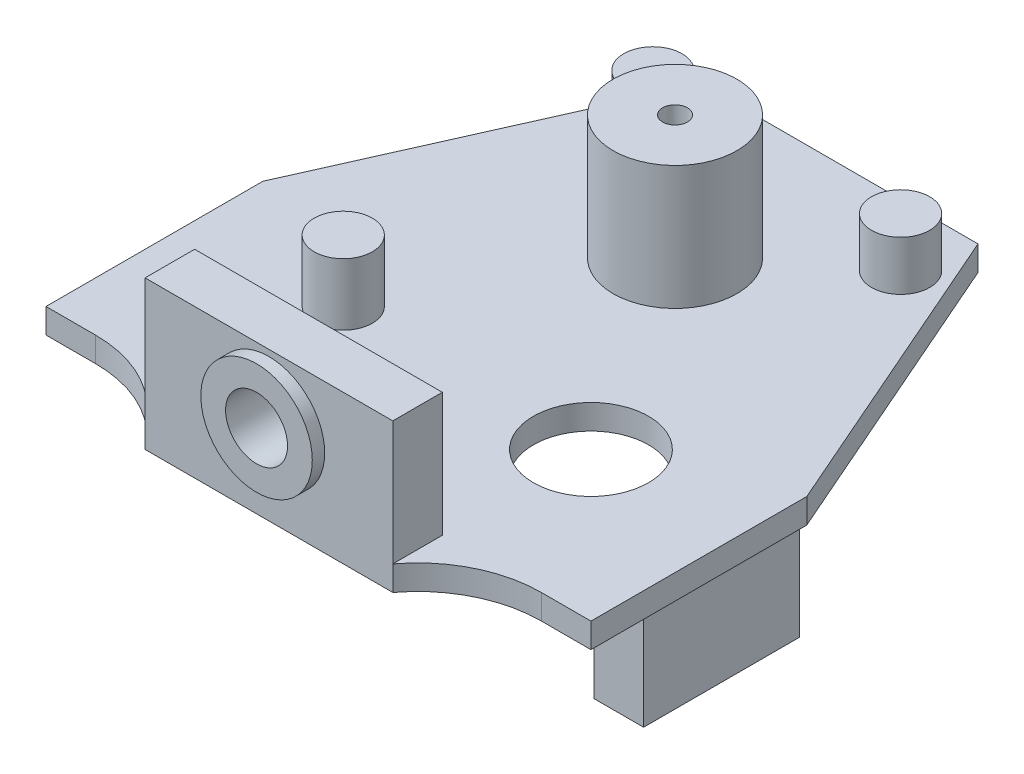
from build123d import *

# Parameters (mm, degrees)
SKETCH1_W                     = 40
SKETCH1_H                     = 20
BOSS_EXTRUDE1_DEPTH           = 2
SKETCH5_W                     = 50
SKETCH5_H                     = 20
BOSS_EXTRUDE4_DEPTH           = 2
SKETCH6_R                     = 2.35
BOSS_EXTRUDE5_DEPTH           = 4
SKETCH15_R                    = 4.65
CUT_EXTRUDE6_DEPTH            = 6
SKETCH17_W                    = 10
SKETCH17_H                    = 20
CUT_EXTRUDE8_DEPTH            = 43.614551505
CUT_EXTRUDE9_DEPTH            = 2
SKETCH19_R                    = 2.35
BOSS_EXTRUDE6_DEPTH           = 5
BOSS_EXTRUDE7_DEPTH           = 2
SKETCH21_R                    = 5
BOSS_EXTRUDE8_DEPTH           = 10
SKETCH22_R                    = 1
CUT_EXTRUDE10_DEPTH           = 8
CUT_EXTRUDE10_DRAFT           = -1
SKETCH23_W                    = 4
SKETCH23_H                    = 12.6
SKETCH23_H_2                  = 12.600139219
BOSS_EXTRUDE9_DEPTH           = 9
SKETCH24_R                    = 1
CUT_EXTRUDE11_DEPTH           = 6
CUT_EXTRUDE11_DRAFT           = -1
CUT_EXTRUDE11_PROFILE_2_DEPTH = 6
CUT_EXTRUDE11_PROFILE_2_DRAFT = -1
SKETCH25_W                    = 20
SKETCH25_H                    = 2
BOSS_EXTRUDE10_DEPTH          = 4
SKETCH26_W                    = 20
SKETCH26_H                    = 4
BOSS_EXTRUDE11_DEPTH          = 10
FILLET1_R                     = 10
SKETCH27_R                    = 1
CUT_EXTRUDE13_DEPTH           = 49.908077043
SKETCH28_R                    = 2.5
CUT_EXTRUDE14_DEPTH           = 3
BOSS_EXTRUDE12_START          = 1
SKETCH29_R                    = 4.5
SKETCH29_R_2                  = 2.5
BOSS_EXTRUDE12_DEPTH          = 1


with BuildPart() as part:
    # Sketch1 → Boss-Extrude1 (new body)
    with BuildSketch(Plane(origin=(0, 0, 0), x_dir=(1, 0, 0), z_dir=(0, 1, 0))):
        Rectangle(SKETCH1_W, SKETCH1_H)
    extrude(amount=BOSS_EXTRUDE1_DEPTH)

    # Sketch5 → Boss-Extrude4 (add)
    with BuildSketch(Plane(origin=(0, 2, 0), x_dir=(1, 0, 0), z_dir=(0, 1, 0))):
        with Locations((5, 20)):
            Rectangle(SKETCH5_W, SKETCH5_H)
    extrude(amount=-BOSS_EXTRUDE4_DEPTH)

    # Sketch6 → Boss-Extrude5 (add)
    with BuildSketch(Plane(origin=(0, 2, 0), x_dir=(1, 0, 0), z_dir=(0, 1, 0))):
        with Locations(Location((-10, 25, 0), (0, 0, 270))):
            Circle(SKETCH6_R)
        with Locations(Location((10, 25, 0), (0, 0, 270))):
            Circle(SKETCH6_R)
    extrude(amount=BOSS_EXTRUDE5_DEPTH)

    # Sketch15 → Cut-Extrude6 (cut)
    with BuildSketch(Plane(origin=(0, 2, 0), x_dir=(1, 0, 0), z_dir=(0, 1, 0))):
        with Locations(Location((10, 0, 0), (0, 0, 270))):
            Circle(SKETCH15_R)
    extrude(amount=-CUT_EXTRUDE6_DEPTH, mode=Mode.SUBTRACT)

    # Sketch17 → Cut-Extrude8 (cut, through all)
    with BuildSketch(Plane(origin=(0, 2, 0), x_dir=(1, 0, 0), z_dir=(0, 1, 0))):
        with Locations((25, 20)):
            Rectangle(SKETCH17_W, SKETCH17_H)
    extrude(amount=-CUT_EXTRUDE8_DEPTH, mode=Mode.SUBTRACT)

    # Sketch18 → Cut-Extrude9 (cut)
    with BuildSketch(Plane(origin=(0, 2, 0), x_dir=(1, 0, 0), z_dir=(0, 1, 0))):
        Polygon((-11.1, 30), (-20, 10), (-20, 30), align=None)
        Polygon((20, 10), (11.25, 30), (20, 30), align=None)
    extrude(amount=-CUT_EXTRUDE9_DEPTH, mode=Mode.SUBTRACT)

    # Sketch19 → Boss-Extrude6 (add)
    with BuildSketch(Plane(origin=(0, 2, 0), x_dir=(1, 0, 0), z_dir=(0, 1, 0))):
        with Locations(Location((-10, 0, 0), (0, 0, 270))):
            Circle(SKETCH19_R)
    extrude(amount=BOSS_EXTRUDE6_DEPTH)

    # Sketch20 → Boss-Extrude7 (add)
    with BuildSketch(Plane(origin=(0, 2, 0), x_dir=(1, 0, 0), z_dir=(0, 1, 0))):
        Polygon((-20, 10), (-22, 5.505617978), (-22, -12), (-20, -12), (20, -12), (22, -12), (22, 5.428571429), (20, 10), (20, -10), (-20, -10), align=None)
    extrude(amount=-BOSS_EXTRUDE7_DEPTH)

    # Sketch21 → Boss-Extrude8 (add)
    with BuildSketch(Plane(origin=(0, 2, 0), x_dir=(1, 0, 0), z_dir=(0, 1, 0))):
        with Locations(Location((0, 16.787751337, 0), (0, 0, 270))):
            Circle(SKETCH21_R)
    extrude(amount=BOSS_EXTRUDE8_DEPTH)


with BuildPart() as cut_extrude10_tool:
    # Sketch22 → Cut-Extrude10 (with draft: the straight prism first)
    with BuildSketch(Plane(origin=(0, 12, 0), x_dir=(1, 0, 0), z_dir=(0, 1, 0))):
        with Locations((0, 16.787751337)):
            Circle(SKETCH22_R)
    extrude(amount=-CUT_EXTRUDE10_DEPTH)
    # Cut-Extrude10: the draft: its side faces are tilted about the plane it starts from
    cut_extrude10_sides = [cut_extrude10_tool.faces().sort_by_distance(p)[0] for p in [
        (-1, 8, -16.787751337),
    ]]
    draft(cut_extrude10_sides, Plane(origin=(0, 12, 0), x_dir=(1, 0, 0), z_dir=(0, 1, 0)), CUT_EXTRUDE10_DRAFT)


with BuildPart() as part_1:
    add(part.part)

    # Cut-Extrude10: cut by cut_extrude10_tool
    add(cut_extrude10_tool.part, mode=Mode.SUBTRACT)

    # Sketch23 → Boss-Extrude9 (add)
    with BuildSketch(Plane.XZ):
        with Locations((-9.55, 0)):
            Rectangle(SKETCH23_W, SKETCH23_H)
        with Locations((18.549999997, 8.8752e-05)):
            Rectangle(SKETCH23_W, SKETCH23_H_2)
    extrude(amount=BOSS_EXTRUDE9_DEPTH)


with BuildPart() as cut_extrude11_tool:
    # Sketch24 → Cut-Extrude11 (with draft: the straight prism first)
    with BuildSketch(Plane.XZ.offset(9)):
        with Locations((18.267131572, 0.01512814)):
            Circle(SKETCH24_R)
    extrude(amount=-CUT_EXTRUDE11_DEPTH)
    # Cut-Extrude11: the draft: its side faces are tilted about the plane it starts from
    cut_extrude11_sides = [cut_extrude11_tool.faces().sort_by_distance(p)[0] for p in [
        (17.267131572, -6, 0.01512814),
    ]]
    draft(cut_extrude11_sides, Plane.XZ.offset(9), CUT_EXTRUDE11_DRAFT)


with BuildPart() as part_2:
    add(part_1.part)

    # Cut-Extrude11: cut by cut_extrude11_tool
    add(cut_extrude11_tool.part, mode=Mode.SUBTRACT)


with BuildPart() as cut_extrude11_profile_2_tool:
    # Sketch24 → Cut-Extrude11 profile 2 (with draft: the straight prism first)
    with BuildSketch(Plane.XZ.offset(9)):
        with Locations((-9.275, 0)):
            Circle(SKETCH24_R)
    extrude(amount=-CUT_EXTRUDE11_PROFILE_2_DEPTH)
    # Cut-Extrude11 profile 2: the draft: its side faces are tilted about the plane it starts from
    cut_extrude11_profile_2_sides = [cut_extrude11_profile_2_tool.faces().sort_by_distance(p)[0] for p in [
        (-10.275, -6, 0),
    ]]
    draft(cut_extrude11_profile_2_sides, Plane.XZ.offset(9), CUT_EXTRUDE11_PROFILE_2_DRAFT)


with BuildPart() as part_3:
    add(part_2.part)

    # Cut-Extrude11 profile 2: cut by cut_extrude11_profile_2_tool
    add(cut_extrude11_profile_2_tool.part, mode=Mode.SUBTRACT)

    # Sketch25 → Boss-Extrude10 (add)
    with BuildSketch(Plane.XY.offset(12)):
        with Locations((0, 1)):
            Rectangle(SKETCH25_W, SKETCH25_H)
    extrude(amount=BOSS_EXTRUDE10_DEPTH)

    # Sketch26 → Boss-Extrude11 (add)
    with BuildSketch(Plane(origin=(0, 2, 0), x_dir=(1, 0, 0), z_dir=(0, 1, 0))):
        with Locations((0, -14)):
            Rectangle(SKETCH26_W, SKETCH26_H)
    extrude(amount=BOSS_EXTRUDE11_DEPTH)

    # Fillet1
    # the kernel refuses this fillet: 10 mm, written as the material it adds along each edge
    with BuildSketch(Plane(origin=(10, 2, 12), x_dir=(0, 0, 1), z_dir=(0, -1, 0)), Plane(origin=(-10, 0, 12), x_dir=(0, 0, 1), z_dir=(0, 1, 0))) as fillet1_piece_1:
        with BuildLine():
            CenterArc((10, -8), FILLET1_R, 126.869897646, 53.130102354)
            Line((0, -8), (0, 0))
            Line((0, 0), (4, 0))
        make_face()
    extrude(amount=2)

    # Sketch27 → Cut-Extrude13 (cut, through all)
    with BuildSketch(Plane(origin=(0, 0, 12), x_dir=(-1, 0, 0), z_dir=(0, 0, -1))):
        with Locations((0, 7)):
            Circle(SKETCH27_R)
    extrude(amount=-CUT_EXTRUDE13_DEPTH, mode=Mode.SUBTRACT)

    # Sketch28 → Cut-Extrude14 (cut)
    with BuildSketch(Plane.XY.offset(16)):
        with Locations((0, 7)):
            Circle(SKETCH28_R)
    extrude(amount=-CUT_EXTRUDE14_DEPTH, mode=Mode.SUBTRACT)

    # Sketch29 → Boss-Extrude12 (add)
    with BuildSketch(Plane.XY.offset(16).offset(BOSS_EXTRUDE12_START)):
        with Locations((0, 7)):
            Circle(SKETCH29_R)
        with Locations((0, 7)):
            Circle(SKETCH29_R_2, mode=Mode.SUBTRACT)
    extrude(amount=-BOSS_EXTRUDE12_DEPTH)


solid = part_3.part
